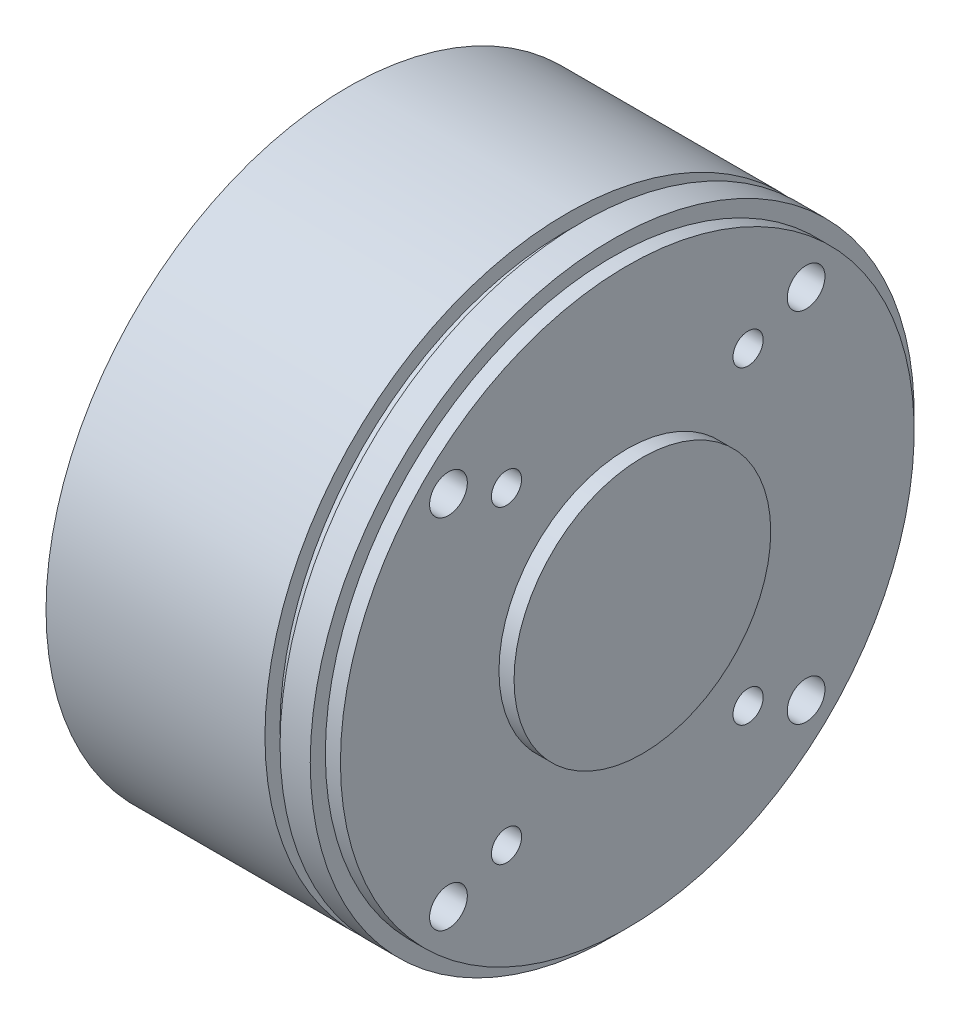
from build123d import *

# Parameters (mm, degrees)
CHAMFER_1_SIZE      = 0.5
SKETCH_2_R          = 1.5
CUT_EXTRUDE_1_DEPTH = 5
SKETCH_3_R          = 1
SKETCH_3_R_2        = 1.25
CUT_EXTRUDE_2_DEPTH = 5


with BuildPart() as part:
    # 草图1 → 旋转1 (revolve)
    with BuildSketch(Plane(origin=(0, 0, 0), x_dir=(1, 0, 0), z_dir=(0, 1, 0)), mode=Mode.PRIVATE) as revolve_1_sk:
        Polygon((0, 19), (1, 19), (1, 20), (3, 20), (3, 19), (4, 19), (4, 8.5), (5, 8.5), (5, 0), (0, 0), (-15, 0), (-15, 15), (-14.5, 15), (-14.5, 20), (0, 20), align=None)
    revolve(revolve_1_sk.sketch.rotate(Axis((-9.646406884, 0, 0), (1, 0, 0)), 180), axis=Axis((-9.646406884, 0, 0), (1, 0, 0)))

    # 倒角1
    chamfer_1_edges = [part.edges().sort_by_distance(p)[0] for p in [
        (-14.5, 0, -15),
    ]]
    chamfer(chamfer_1_edges, length=CHAMFER_1_SIZE - 0.0001)  # a hair under: the kernel refuses the full size

    # 草图2 → 切除-拉伸1 (cut)
    with BuildSketch(Plane.ZY.offset(15)):
        with Locations((0, 10)):
            Circle(SKETCH_2_R)
        with Locations((10, 0)):
            Circle(SKETCH_2_R)
        with Locations((0, -10)):
            Circle(SKETCH_2_R)
        with Locations((-10, 0)):
            Circle(SKETCH_2_R)
    extrude(amount=-CUT_EXTRUDE_1_DEPTH, mode=Mode.SUBTRACT)

    # 草图3 → 切除-拉伸2 (cut)
    with BuildSketch(Plane(origin=(5, 0, 0), x_dir=(0, 0, -1), z_dir=(1, 0, 0))):
        with Locations((-8, 10.25)):
            Circle(SKETCH_3_R)
        with Locations(Location((8, 10.25, 0), (0, 0, 180))):
            Circle(SKETCH_3_R)
        with Locations((8, -10.25)):
            Circle(SKETCH_3_R)
        with Locations(Location((-8, -10.25, 0), (0, 0, 180))):
            Circle(SKETCH_3_R)
        with Locations((-11.844038585, 11.844038585)):
            Circle(SKETCH_3_R_2)
        with Locations((11.844038585, 11.844038585)):
            Circle(SKETCH_3_R_2)
        with Locations((11.844038585, -11.844038585)):
            Circle(SKETCH_3_R_2)
        with Locations((-11.844038585, -11.844038585)):
            Circle(SKETCH_3_R_2)
    extrude(amount=-CUT_EXTRUDE_2_DEPTH, mode=Mode.SUBTRACT)


solid = part.part
